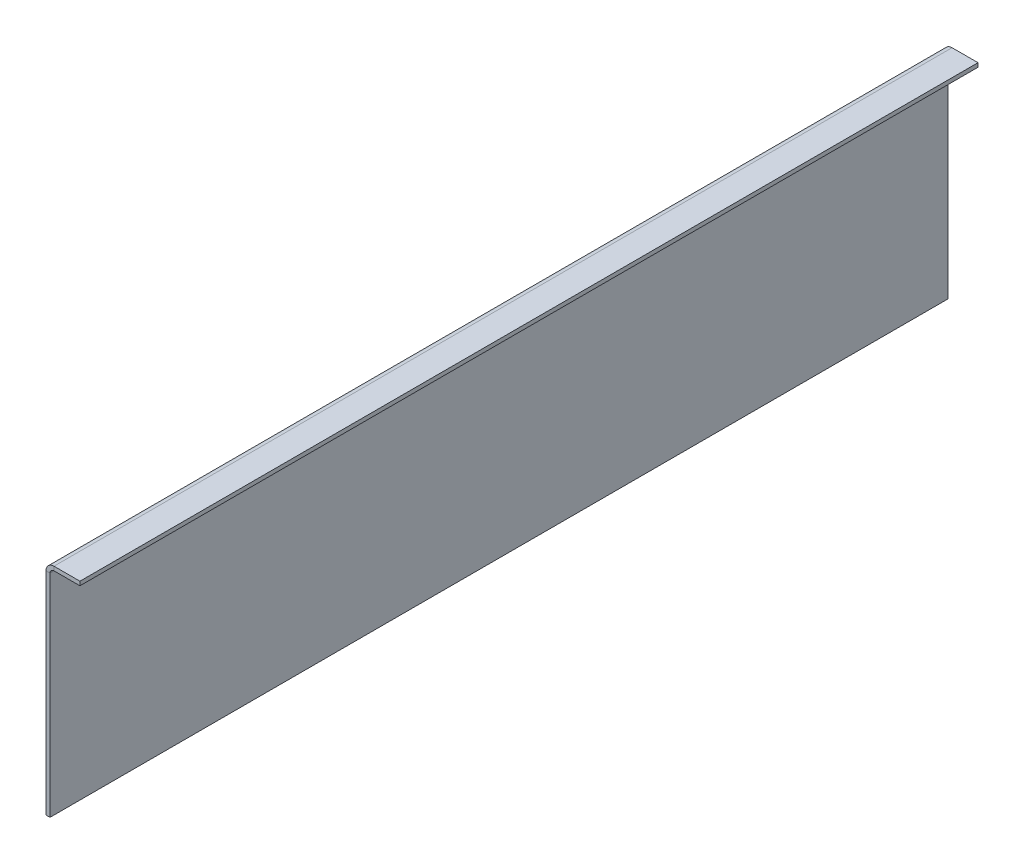
from build123d import *

# Parameters (mm, degrees)
BOSS_EXTRUDE1_DEPTH    = 225
CONVERT_SOLID1_START   = -225
CONVERT_SOLID1_DEPTH   = 450
CONVERT_SOLID1_2_DEPTH = 450


# Read off the part's stored shape, not the designer's step: Convert-Solid1
with BuildPart() as part:
    # Sketch1 → Boss-Extrude1 (new, symmetric)
    with BuildSketch(Plane.XY):
        Polygon((0, 0), (0, 110), (17, 110), (17, 108), (2, 108), (2, 0), align=None)
    extrude(amount=BOSS_EXTRUDE1_DEPTH, both=True)

    # Convert-Solid1 outline → Convert-Solid1 (cut)
    with BuildSketch(Plane.XY.offset(CONVERT_SOLID1_START)):
        with BuildLine():
            ThreePointArc((0, 106), (1.171572875, 108.828427125), (4, 110))
            Line((4, 110), (0, 110))
            Line((0, 110), (0, 106))
        make_face()
    extrude(amount=CONVERT_SOLID1_DEPTH, mode=Mode.SUBTRACT)

    # Convert-Solid1 2 outline → Convert-Solid1 2 (add)
    with BuildSketch(Plane.XY.offset(CONVERT_SOLID1_START)):
        with BuildLine():
            ThreePointArc((2, 106), (2.585786438, 107.414213562), (4, 108))
            Line((4, 108), (2, 108))
            Line((2, 108), (2, 106))
        make_face()
    extrude(amount=CONVERT_SOLID1_2_DEPTH)


solid = part.part
